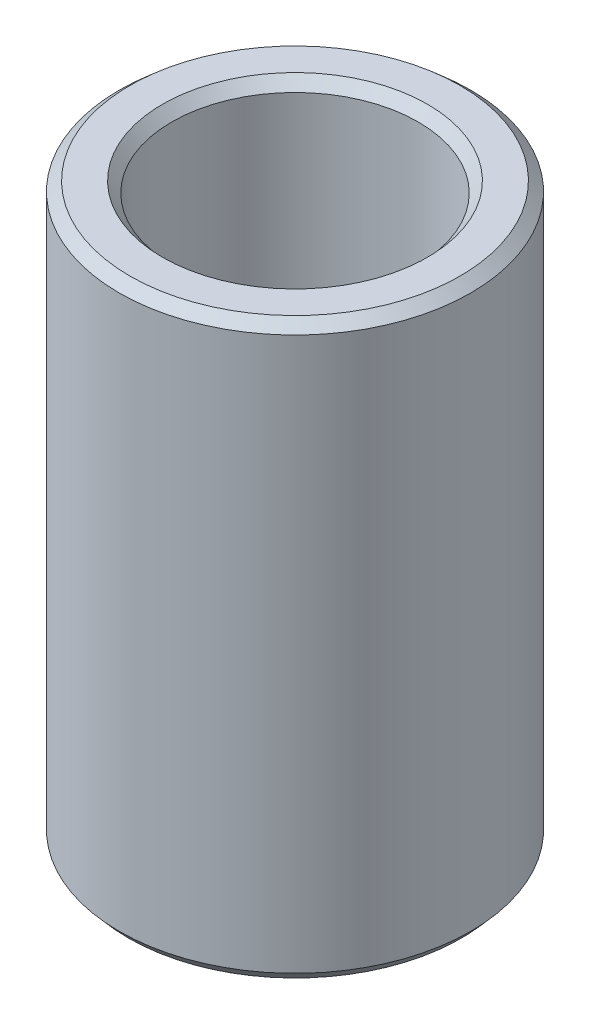
from build123d import *
from OCP.BRepFilletAPI import BRepFilletAPI_MakeChamfer

# Parameters (mm, degrees)
SKETCH1_R           = 42.5
BOSS_EXTRUDE1_DEPTH = 138.522134954
SKETCH2_R           = 29.797371206
CUT_EXTRUDE1_DEPTH  = 151.999608848
CHAMFER1_SIZE       = 2.259511767
CHAMFER1_SIZE2      = 2.574633484


with BuildPart() as part:
    # Sketch1 → Boss-Extrude1 (new body)
    with BuildSketch(Plane(origin=(0, 0, 0), x_dir=(1, 0, 0), z_dir=(0, 1, 0))):
        Circle(SKETCH1_R)
    extrude(amount=BOSS_EXTRUDE1_DEPTH)

    # Sketch2 → Cut-Extrude1 (cut, through all)
    with BuildSketch(Plane(origin=(0, 0, 0), x_dir=(1, 0, 0), z_dir=(0, 1, 0))):
        Circle(SKETCH2_R)
    extrude(amount=CUT_EXTRUDE1_DEPTH, mode=Mode.SUBTRACT)

    # Chamfer1: one chamfer whose edges measure the first distance from different faces: ONE call of the kernel's chamfer builder (chamfer() names one face for all edges)
    chamfer1_edges_1 = [part.edges().sort_by_distance(p)[0] for p in [
        (-29.797371206, 138.522134954, 0),
    ]]
    chamfer1_side_1 = [part.faces().sort_by_distance(p)[0] for p in [
        (-41.297918472, 138.522134954, 0),
    ]]
    chamfer1_edges_2 = [part.edges().sort_by_distance(p)[0] for p in [
        (-29.797371206, 0, 0),
    ]]
    chamfer1_side_2 = [part.faces().sort_by_distance(p)[0] for p in [
        (-29.797371206, 69.261067477, 0),
    ]]
    chamfer1_edges_3 = [part.edges().sort_by_distance(p)[0] for p in [
        (-42.5, 0, 0),
    ]]
    chamfer1_side_3 = [part.faces().sort_by_distance(p)[0] for p in [
        (-41.297918472, 0, 0),
    ]]
    chamfer1_edges_4 = [part.edges().sort_by_distance(p)[0] for p in [
        (-42.5, 138.522134954, 0),
    ]]
    chamfer1_side_4 = [part.faces().sort_by_distance(p)[0] for p in [
        (-42.5, 69.261067477, 0),
    ]]
    chamfer1 = BRepFilletAPI_MakeChamfer(part.part.solid().wrapped)
    for e in chamfer1_edges_1:
        chamfer1.Add(CHAMFER1_SIZE, CHAMFER1_SIZE2, e.wrapped, chamfer1_side_1[0].wrapped)  # the first distance lies on this face
    for e in chamfer1_edges_2:
        chamfer1.Add(CHAMFER1_SIZE, CHAMFER1_SIZE2, e.wrapped, chamfer1_side_2[0].wrapped)  # the first distance lies on this face
    for e in chamfer1_edges_3:
        chamfer1.Add(CHAMFER1_SIZE, CHAMFER1_SIZE2, e.wrapped, chamfer1_side_3[0].wrapped)  # the first distance lies on this face
    for e in chamfer1_edges_4:
        chamfer1.Add(CHAMFER1_SIZE, CHAMFER1_SIZE2, e.wrapped, chamfer1_side_4[0].wrapped)  # the first distance lies on this face
    add(Compound.cast(chamfer1.Shape()), mode=Mode.REPLACE)


solid = part.part
